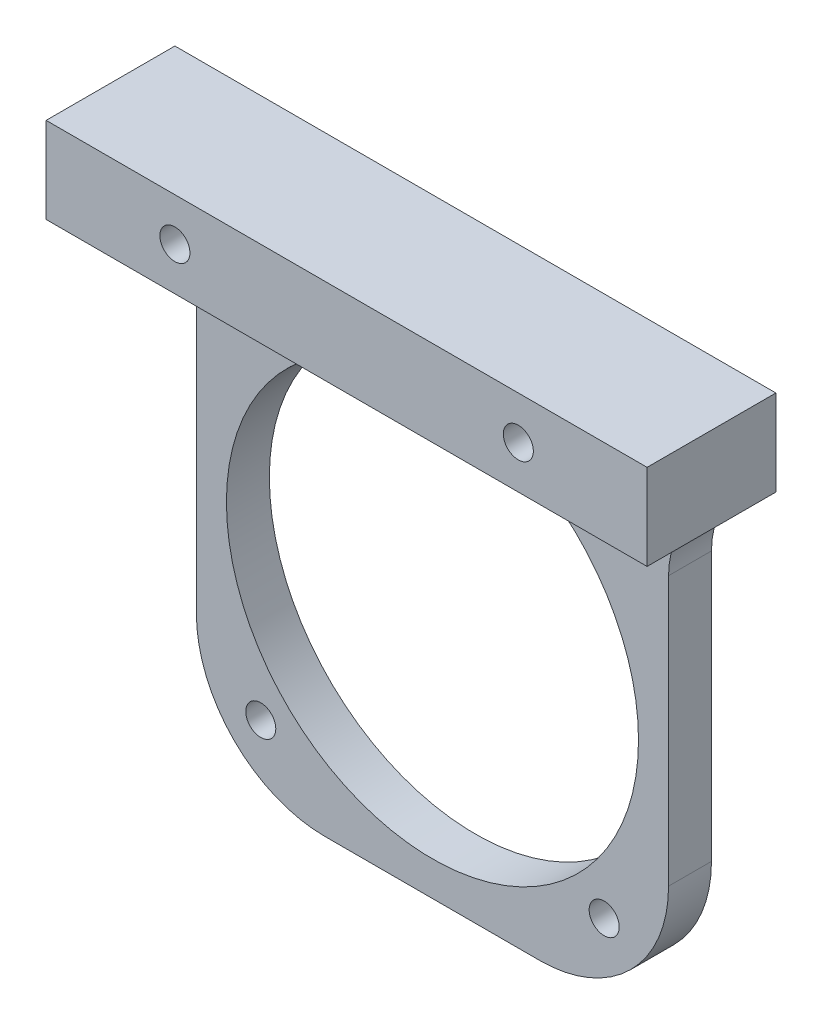
from build123d import *

# Parameters (mm, degrees)
ESQUISSE1_W             = 55
ESQUISSE1_H             = 56
ESQUISSE1_R             = 1.75
ESQUISSE1_R_2           = 24
BOSS_EXTRU_1_DEPTH      = 5
CONG_1_R                = 15
ESQUISSE2_W             = 70
ESQUISSE2_H             = 10
BOSS_EXTRU_2_DEPTH      = 10
ESQUISSE3_R             = 1.75
ENL_V_MAT_EXTRU_1_DEPTH = 26
ENL_V_MAT_EXTRU_2_DEPTH = 2
CONG_2_R                = 10


with BuildPart() as part:
    # Esquisse1 → Boss.-Extru.1 (new body)
    # profile 1 of 2: a face of its own
    with BuildSketch(Plane.XY):
        Rectangle(ESQUISSE1_W, ESQUISSE1_H)
        with Locations((-20, -20)):
            Circle(ESQUISSE1_R, mode=Mode.SUBTRACT)
        with Locations((20, -20)):
            Circle(ESQUISSE1_R, mode=Mode.SUBTRACT)
        with Locations((20, 20)):
            Circle(ESQUISSE1_R, mode=Mode.SUBTRACT)
        with Locations((-20, 20)):
            Circle(ESQUISSE1_R, mode=Mode.SUBTRACT)
        Circle(ESQUISSE1_R_2, mode=Mode.SUBTRACT)
    # profile 2 of 2: a face of its own
    with BuildSketch(Plane.XY):
        Polygon((-35, 28), (-27.5, 28), (27.5, 28), (35, 28), (35, 38), (-35, 38), align=None)
    extrude(amount=BOSS_EXTRU_1_DEPTH)

    # Congé1
    cong_1_edges = [part.edges().sort_by_distance(p)[0] for p in [
        (27.5, -28, 2.5),
        (-27.5, -28, 2.5),
    ]]
    fillet(cong_1_edges, radius=CONG_1_R)

    # Esquisse2 → Boss.-Extru.2 (add)
    with BuildSketch(Plane.XY.offset(5)):
        with Locations((0, 33)):
            Rectangle(ESQUISSE2_W, ESQUISSE2_H)
    extrude(amount=BOSS_EXTRU_2_DEPTH)

    # Esquisse3 → Enlèv. mat.-Extru.1 (cut)
    with BuildSketch(Plane.XY.offset(15)):
        with Locations((-20, 33)):
            Circle(ESQUISSE3_R)
        with Locations((20, 33)):
            Circle(ESQUISSE3_R)
    extrude(amount=-ENL_V_MAT_EXTRU_1_DEPTH, mode=Mode.SUBTRACT)

    # Esquisse4 → Enlèv. mat.-Extru.2 (cut)
    with BuildSketch(Plane(origin=(0, 0, 0), x_dir=(-1, 0, 0), z_dir=(0, 0, -1))):
        Polygon((-16.709103466, 33), (-18.354551733, 35.85), (-21.645448267, 35.85), (-23.290896534, 33), (-21.645448267, 30.15), (-18.354551733, 30.15), align=None)
        Polygon((16.709103466, 33), (18.354551733, 30.15), (21.645448267, 30.15), (23.290896534, 33), (21.645448267, 35.85), (18.354551733, 35.85), align=None)
    extrude(amount=-ENL_V_MAT_EXTRU_2_DEPTH, mode=Mode.SUBTRACT)

    # Congé2
    # the kernel refuses this fillet: 10 mm, written as the material it adds along each edge
    with BuildSketch(Plane(origin=(-27.5, 28, 0), x_dir=(0, -1, 0), z_dir=(0, 0, 1))) as cong_2_piece_1:
        with BuildLine():
            CenterArc((9.682458366, -10), CONG_2_R, 90, 75.522487814)
            Line((0, -7.5), (-0.193649167, -7.45))
            ThreePointArc((-0.193649167, -7.45), (-0.2, -3.75), (-0.2, 0))
            Line((-0.2, 0), (0, 0.2))
            Line((0, 0.2), (9.682458366, 0.2))
            Line((9.682458366, 0.2), (9.682458366, 0))
        make_face()
    extrude(amount=5)
    with BuildSketch(Plane(origin=(27.5, 28, 0), x_dir=(1, 0, 0), z_dir=(0, 0, 1))) as cong_2_piece_2:
        with BuildLine():
            CenterArc((10, -9.682458366), CONG_2_R, 104.477512186, 75.522487814)
            Line((0, -9.682458366), (-0.2, -9.682458366))
            Line((-0.2, -9.682458366), (-0.2, 0))
            Line((-0.2, 0), (0, 0.2))
            ThreePointArc((0, 0.2), (3.75, 0.2), (7.45, 0.193649167))
            Line((7.45, 0.193649167), (7.5, 0))
        make_face()
    extrude(amount=5)


solid = part.part
